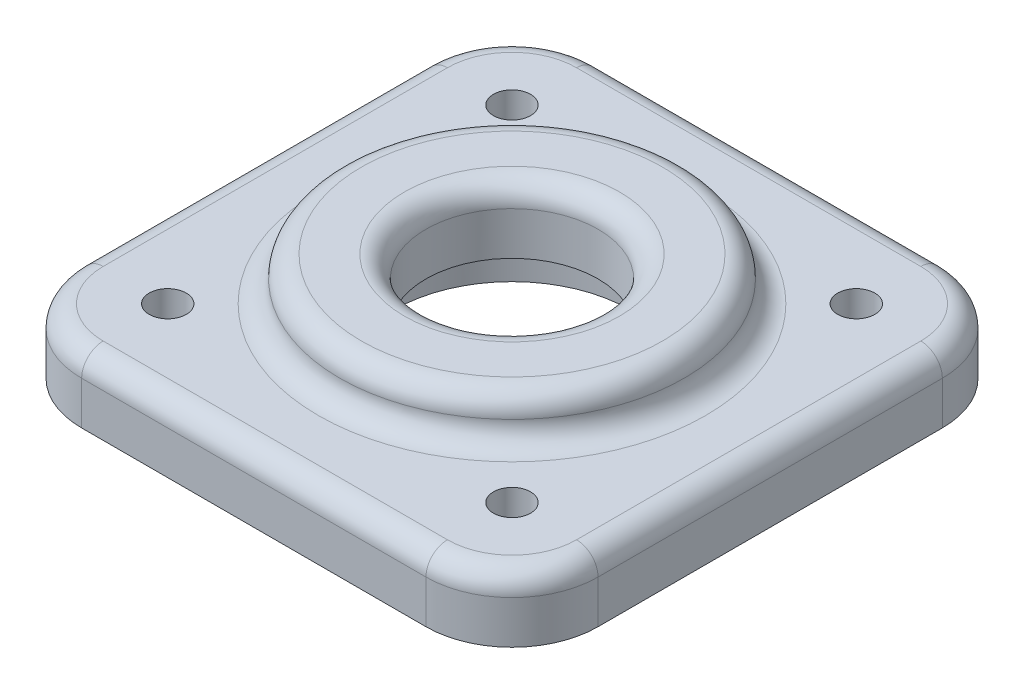
from build123d import *

# Parameters (mm, degrees)
SKETCH1_R           = 0.861723991
SKETCH1_R_2         = 5.5
BOSS_EXTRUDE1_DEPTH = 3
SKETCH2_R           = 8
SKETCH2_R_2         = 4
BOSS_EXTRUDE2_DEPTH = 2
FILLET1_R           = 1
BOSS_EXTRUDE3_START = 1
SKETCH3_R           = 5.5
SKETCH3_R_2         = 4
BOSS_EXTRUDE3_DEPTH = 1


with BuildPart() as part:
    # Sketch1 → Boss-Extrude1 (new body)
    with BuildSketch(Plane(origin=(0, 0, 0), x_dir=(1, 0, 0), z_dir=(0, 1, 0))):
        with BuildLine():
            Line((-8, 12), (8, 12))
            ThreePointArc((8, 12), (10.828427125, 10.828427125), (12, 8))
            Line((12, 8), (12, -8))
            ThreePointArc((12, -8), (10.828427125, -10.828427125), (8, -12))
            Line((8, -12), (-8, -12))
            ThreePointArc((-8, -12), (-10.828427125, -10.828427125), (-12, -8))
            Line((-12, -8), (-12, 8))
            ThreePointArc((-12, 8), (-10.828427125, 10.828427125), (-8, 12))
        make_face()
        with Locations(Location((-8, 8, 0), (0, 0, 270))):
            Circle(SKETCH1_R, mode=Mode.SUBTRACT)
        with Locations(Location((8, 8, 0), (0, 0, 270))):
            Circle(SKETCH1_R, mode=Mode.SUBTRACT)
        with Locations(Location((8, -8, 0), (0, 0, 270))):
            Circle(SKETCH1_R, mode=Mode.SUBTRACT)
        with Locations(Location((-8, -8, 0), (0, 0, 270))):
            Circle(SKETCH1_R, mode=Mode.SUBTRACT)
        with Locations(Location((0, 0, 0), (0, 0, 270))):
            Circle(SKETCH1_R_2, mode=Mode.SUBTRACT)
    extrude(amount=BOSS_EXTRUDE1_DEPTH)

    # Sketch2 → Boss-Extrude2 (add)
    with BuildSketch(Plane(origin=(0, 3, 0), x_dir=(1, 0, 0), z_dir=(0, 1, 0))):
        with Locations(Location((0, 0, 0), (0, 0, 270))):
            Circle(SKETCH2_R)
        with Locations(Location((0, 0, 0), (0, 0, 270))):
            Circle(SKETCH2_R_2, mode=Mode.SUBTRACT)
    extrude(amount=BOSS_EXTRUDE2_DEPTH)

    # Fillet1
    fillet1_edges = [part.edges().sort_by_distance(p)[0] for p in [
        (-10.828427125, 3, 10.828427125),
        (0, 3, 12),
        (10.828427125, 3, 10.828427125),
        (12, 3, 0),
        (10.828427125, 3, -10.828427125),
        (0, 3, -12),
        (-10.828427125, 3, -10.828427125),
        (0, 5, -8),
        (0, 3, -8),
        (0, 5, -4),
        (-12, 3, 0),
    ]]
    fillet(fillet1_edges, radius=FILLET1_R - 0.0001)  # a hair under: the kernel refuses the full size

    # Sketch3 → Boss-Extrude3 (add)
    with BuildSketch(Plane.XZ.offset(-3).offset(BOSS_EXTRUDE3_START)):
        with Locations(Location((0, 0, 0), (0, 0, 270))):
            Circle(SKETCH3_R)
        with Locations(Location((0, 0, 0), (0, 0, 270))):
            Circle(SKETCH3_R_2, mode=Mode.SUBTRACT)
    extrude(amount=-BOSS_EXTRUDE3_DEPTH)


solid = part.part
